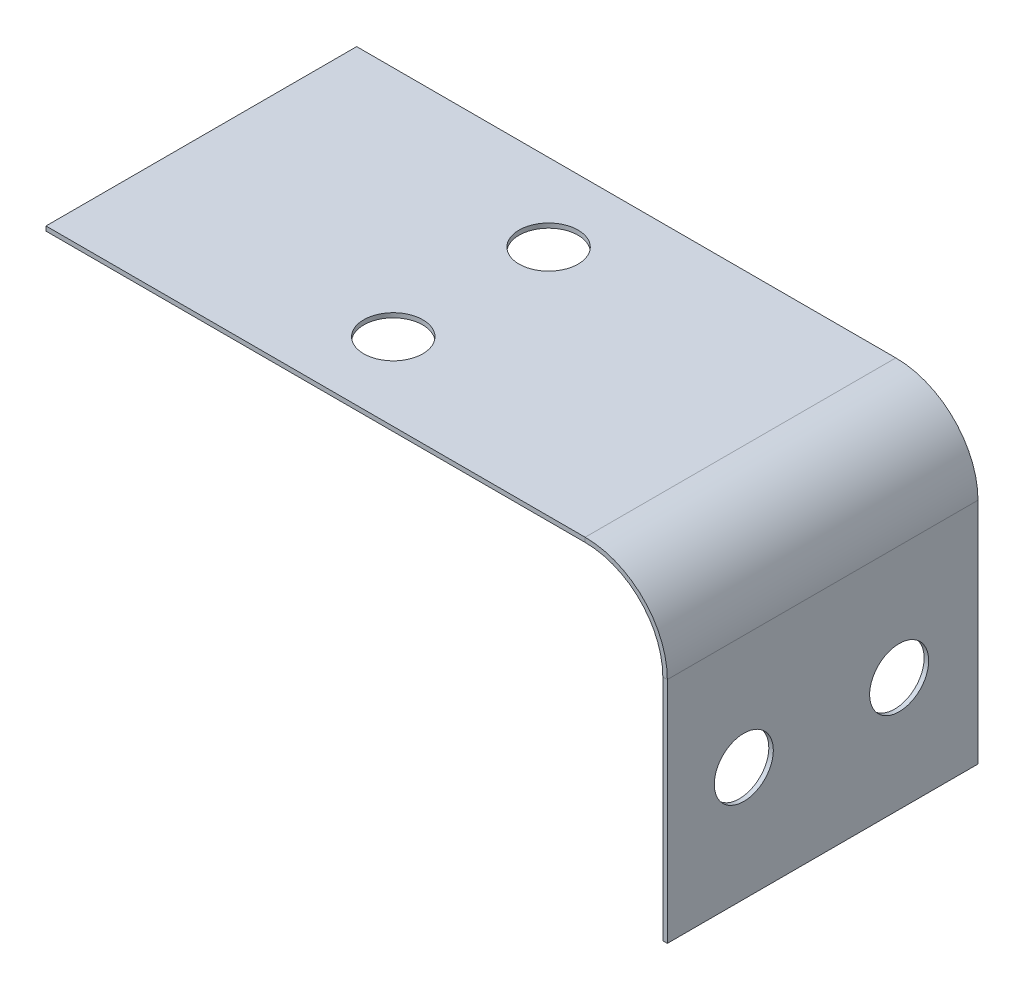
from build123d import *

# Parameters (mm, degrees)
BASE_FLANGE1_DEPTH = 50.8
SKETCH7_R          = 4.826
CUT_EXTRUDE1_DEPTH = 2.54
SKETCH8_R          = 4.826
CUT_EXTRUDE2_DEPTH = 2.54


# Sheet-metal steps are written as plain solids
with BuildPart() as part:
    # Sketch2 → Base-Flange1 (new body)
    with BuildSketch(Plane.XY):
        with BuildLine():
            Line((-72.359580073, 0), (15.803819927, 0))
            ThreePointArc((15.803819927, 0), (25.304930904, -3.935489024), (29.240419927, -13.4366))
            Line((29.240419927, -13.4366), (29.240419927, -50.8))
            Line((29.240419927, -50.8), (28.503819927, -50.8))
            Line((28.503819927, -50.8), (28.503819927, -13.4366))
            ThreePointArc((28.503819927, -13.4366), (24.784076049, -4.456343879), (15.803819927, -0.7366))
            Line((15.803819927, -0.7366), (-72.359580073, -0.7366))
            Line((-72.359580073, -0.7366), (-72.359580073, 0))
        make_face()
    extrude(amount=BASE_FLANGE1_DEPTH)

    # Sketch7 → Cut-Extrude1 (cut)
    with BuildSketch(Plane(origin=(29.240419927, 0, 0), x_dir=(0, 0, -1), z_dir=(1, 0, 0))):
        with Locations(Location((-12.894872644, -32.1183, 0), (0, 0, 90))):
            Circle(SKETCH7_R)
        with Locations(Location((-38.294872644, -32.1183, 0), (0, 0, 90))):
            Circle(SKETCH7_R)
    extrude(amount=-CUT_EXTRUDE1_DEPTH, mode=Mode.SUBTRACT)

    # Sketch8 → Cut-Extrude2 (cut)
    with BuildSketch(Plane(origin=(0, 0, 0), x_dir=(1, 0, 0), z_dir=(0, 1, 0))):
        with Locations(Location((-28.277880073, -38.1, 0), (0, 0, 270))):
            Circle(SKETCH8_R)
        with Locations(Location((-28.277880073, -12.7, 0), (0, 0, 270))):
            Circle(SKETCH8_R)
    extrude(amount=-CUT_EXTRUDE2_DEPTH, mode=Mode.SUBTRACT)


solid = part.part
